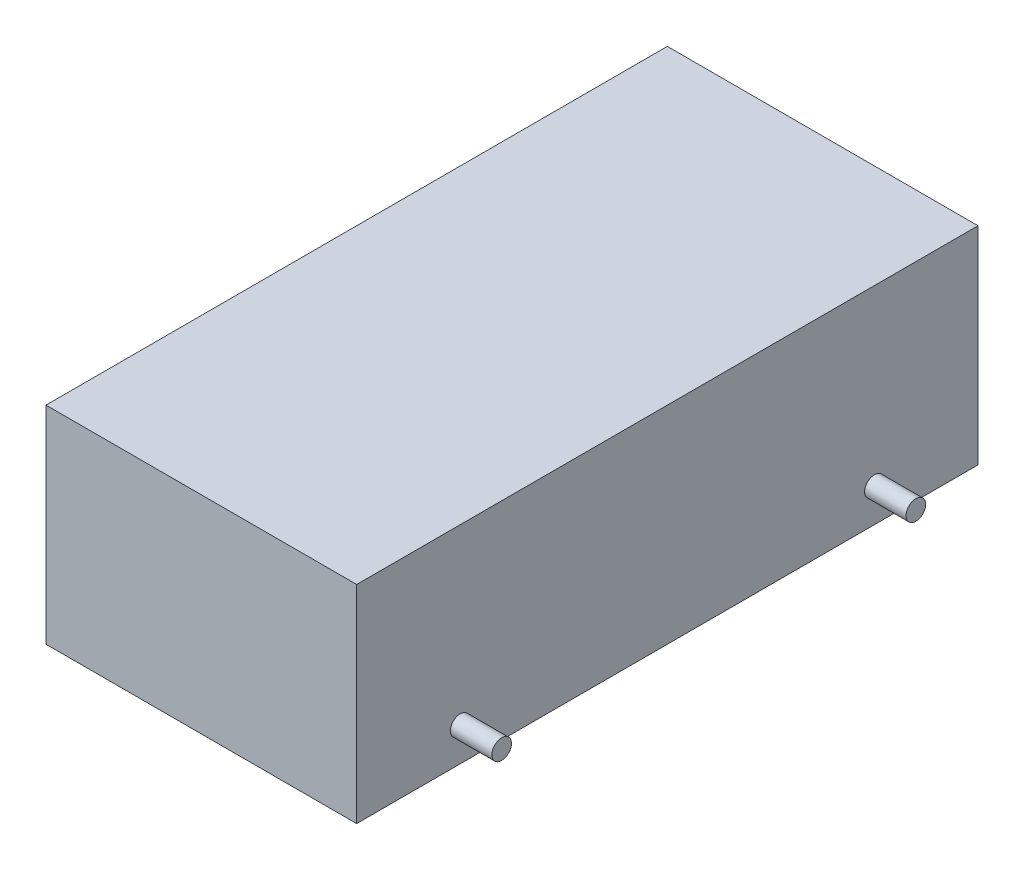
from build123d import *

# Parameters (mm, degrees)
SKETCH1_W           = 75
SKETCH1_H           = 50
BOSS_EXTRUDE1_DEPTH = 150
SKETCH2_R           = 2.369647205
BOSS_EXTRUDE2_DEPTH = 10
BOSS_EXTRUDE3_START = 10
SKETCH3_R           = 2.369647205
BOSS_EXTRUDE3_DEPTH = 10


with BuildPart() as part:
    # Sketch1 → Boss-Extrude1 (new body)
    with BuildSketch(Plane.XY):
        Rectangle(SKETCH1_W, SKETCH1_H)
    extrude(amount=BOSS_EXTRUDE1_DEPTH)

    # Sketch2 → Boss-Extrude2 (add)
    with BuildSketch(Plane(origin=(37.5, 0, 0), x_dir=(0, 0, -1), z_dir=(1, 0, 0))):
        with Locations((-125, -16.919154578)):
            Circle(SKETCH2_R)
        with Locations((-25, -16.919154578)):
            Circle(SKETCH2_R)
    extrude(amount=BOSS_EXTRUDE2_DEPTH)

    # Sketch3 → Boss-Extrude3 (add)
    with BuildSketch(Plane.ZY.offset(37.5).offset(BOSS_EXTRUDE3_START)):
        with Locations((25, -16.919154578)):
            Circle(SKETCH3_R)
        with Locations((125, -16.919154578)):
            Circle(SKETCH3_R)
    extrude(amount=-BOSS_EXTRUDE3_DEPTH)


solid = part.part
